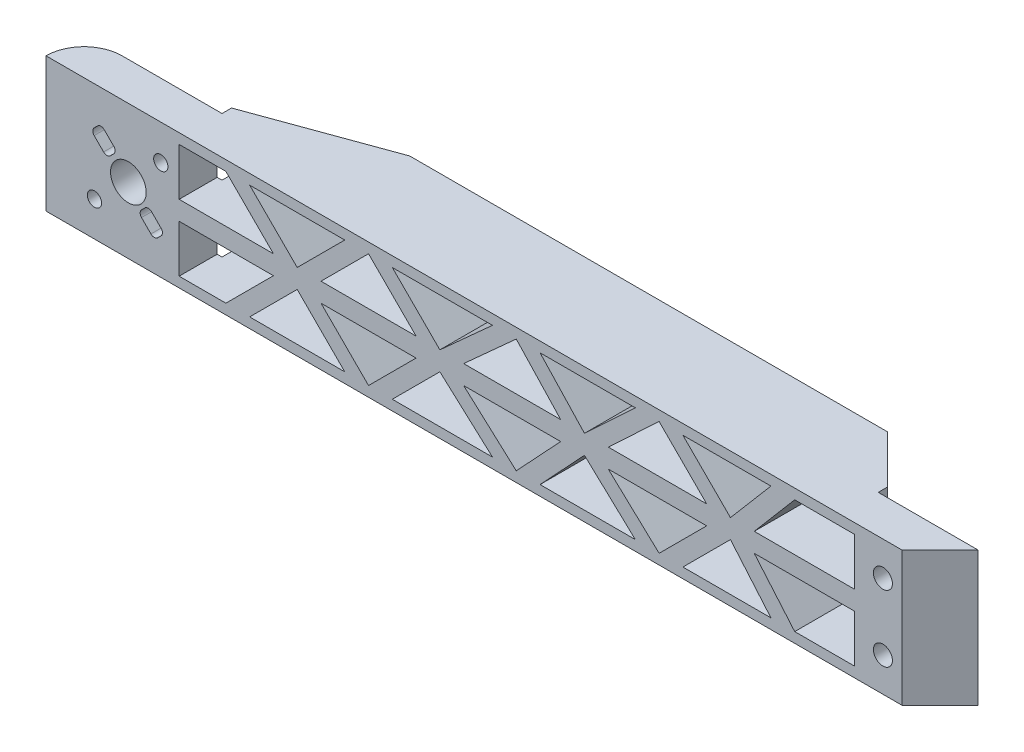
from build123d import *

# Parameters (mm, degrees)
ESQUISSE1_W         = 200
ESQUISSE1_H         = 28.284
BOSS_EXTRU_3_DEPTH  = 8
CHANFREIN1_SIZE     = 20
ESQUISSE4_R         = 2
CUT_EXTRUDE5_DEPTH  = 30
FILLET1_R           = 8
SKETCH2_R           = 1.5
SKETCH2_R_2         = 3.75
CUT_EXTRUDE1_DEPTH  = 8
FILLET9_R           = 1
FILLET10_R          = 1
SKETCH6_W           = 138
SKETCH6_H           = 28.284
BOSS_EXTRUDE3_DEPTH = 12
CHAMFER2_SIZE       = 10
CHAMFER2_SIZE2      = 27.474774195
CUT_EXTRUDE6_DEPTH  = 20
CHAMFER8_SIZE       = 10
CHAMFER9_SIZE       = 10


# Some blends are built 0.0001 mm under size
with BuildPart() as part:
    # Esquisse1 → Boss.-Extru.3 (new body)
    with BuildSketch(Plane.XY):
        with Locations((100, 14.142)):
            Rectangle(ESQUISSE1_W, ESQUISSE1_H)
    extrude(amount=BOSS_EXTRU_3_DEPTH)

    # Chanfrein1
    # the kernel refuses this chamfer: 20 mm, written as the material it takes off along each edge
    with BuildSketch(Plane(origin=(200, -51.433659759, 8), x_dir=(0.027495876610586317, 0, -0.9996219169112968), z_dir=(0, 1, 0))) as chanfrein1_piece_1:
        Polygon((CHANFREIN1_SIZE * 0.999621916911, CHANFREIN1_SIZE * 0.0274958766106), (-CHANFREIN1_SIZE * 0.0274958766106, CHANFREIN1_SIZE * 0.999621916911), (0, 0), align=None)
    extrude(amount=131.151319519, mode=Mode.SUBTRACT)

    # Esquisse4 → Cut-Extrude5 (cut)
    with BuildSketch(Plane.XY.offset(8)):
        with Locations((176, 7.142)):
            Circle(ESQUISSE4_R)
        with Locations((176, 21.142)):
            Circle(ESQUISSE4_R)
    extrude(amount=-CUT_EXTRUDE5_DEPTH, mode=Mode.SUBTRACT)

    # Fillet1
    fillet1_edges = [part.edges().sort_by_distance(p)[0] for p in [
        (0, 14.142, 0),
    ]]
    fillet(fillet1_edges, radius=FILLET1_R - 0.0001)  # a hair under: the kernel refuses the full size

    # Sketch2 → Cut-Extrude1 (cut)
    with BuildSketch(Plane.XY.offset(8)):
        with Locations((10.180485171, 7.281517741)):
            Circle(SKETCH2_R)
        with Locations((24.142857006, 20.883346587)):
            Circle(SKETCH2_R)
        with Locations((17.323003706, 13.918303783)):
            Circle(SKETCH2_R_2)
        Polygon((14.943517177, 18.243352736), (12.822196834, 16.122032392), (9.422196834, 19.522032392), (11.543517177, 21.643352736), align=None)
        Polygon((19.379761465, 9.564467761), (22.780003771, 6.164594852), (24.901208877, 8.286030428), (21.501081812, 11.685788108), align=None)
    extrude(amount=-CUT_EXTRUDE1_DEPTH, mode=Mode.SUBTRACT)

    # Fillet9
    fillet9_edges = [part.edges().sort_by_distance(p)[0] for p in [
        (9.422196834, 19.522032392, 4),
        (11.543517177, 21.643352736, 4),
        (14.943517177, 18.243352736, 4),
        (12.822196834, 16.122032392, 4),
    ]]
    fillet(fillet9_edges, radius=FILLET9_R)

    # Fillet10
    fillet10_edges = [part.edges().sort_by_distance(p)[0] for p in [
        (24.901208877, 8.286030428, 4),
        (22.780003771, 6.164594852, 4),
        (19.379761465, 9.564467761, 4),
        (21.501081812, 11.685788108, 4),
    ]]
    fillet(fillet10_edges, radius=FILLET10_R)

    # Sketch6 → Boss-Extrude3 (add)
    with BuildSketch(Plane(origin=(0, 0, 0), x_dir=(-1, 0, 0), z_dir=(0, 0, -1))):
        with Locations((-98.018199025, 14.142)):
            Rectangle(SKETCH6_W, SKETCH6_H)
    extrude(amount=BOSS_EXTRUDE3_DEPTH)

    # Chamfer2
    chamfer2_edges = [part.edges().sort_by_distance(p)[0] for p in [
        (29.018199025, 14.142, -12),
    ]]
    chamfer2_side = [part.faces().sort_by_distance(p)[0] for p in [
        (29.018199025, 14.142, -6),
    ]]
    chamfer(chamfer2_edges, length=CHAMFER2_SIZE, length2=CHAMFER2_SIZE2, reference=chamfer2_side[0])

    # Sketch4 → Cut-Extrude6 (cut)
    with BuildSketch(Plane.XY.offset(8)):
        Polygon((47.82891302, 12.144), (28, 12.144), (28, 2.144), (37.82891302, 2.144), align=None)
        Polygon((62.82891302, 2.144), (52.82891302, 12.144), (42.82891302, 2.144), align=None)
        Polygon((77.82891302, 12.144), (57.82891302, 12.144), (67.82891302, 2.144), align=None)
        Polygon((82.82891302, 12.144), (72.82891302, 2.144), (93.894603713, 2.144), align=None)
        Polygon((108.238219115, 12.144), (87.82891302, 12.144), (98.894603713, 2.144), align=None)
        Polygon((113.238219115, 12.144), (103.894603713, 2.144), (123.940714423, 2.144), align=None)
        Polygon((138.940714423, 12.144), (118.238219115, 12.144), (128.940714423, 2.144), align=None)
        Polygon((143.940714423, 12.144), (133.940714423, 2.144), (152.455696505, 2.144), align=None)
        Polygon((170, 12.144), (148.940714423, 12.144), (157.455696505, 2.144), (170, 2.144), align=None)
        Polygon((157.455696505, 26.144), (148.940714423, 16.144), (170, 16.144), (170, 26.144), align=None)
        Polygon((152.455696505, 26.144), (133.940714423, 26.144), (143.940714423, 16.144), align=None)
        Polygon((128.940714423, 26.144), (118.238219115, 16.144), (138.940714423, 16.144), align=None)
        Polygon((123.940714423, 26.144), (103.894603713, 26.144), (113.238219115, 16.144), align=None)
        Polygon((98.894603713, 26.144), (87.82891302, 16.144), (108.238219115, 16.144), align=None)
        Polygon((93.894603713, 26.144), (72.82891302, 26.144), (82.82891302, 16.144), align=None)
        Polygon((67.82891302, 26.144), (57.82891302, 16.144), (77.82891302, 16.144), align=None)
        Polygon((62.82891302, 26.144), (42.82891302, 26.144), (52.82891302, 16.144), align=None)
        Polygon((37.82891302, 26.144), (28, 26.144), (28, 16.144), (47.82891302, 16.144), align=None)
    extrude(amount=-CUT_EXTRUDE6_DEPTH, mode=Mode.SUBTRACT)

    # Chamfer8
    chamfer8_edges = [part.edges().sort_by_distance(p)[0] for p in [
        (167.018199025, 1.072, -12),
        (167.018199025, 14.144, -12),
    ]]
    chamfer(chamfer8_edges, length=CHAMFER8_SIZE)

    # Chamfer9
    chamfer9_edges = [part.edges().sort_by_distance(p)[0] for p in [
        (167.018199025, 27.214, -12),
    ]]
    chamfer(chamfer9_edges, length=CHAMFER9_SIZE)


solid = part.part
